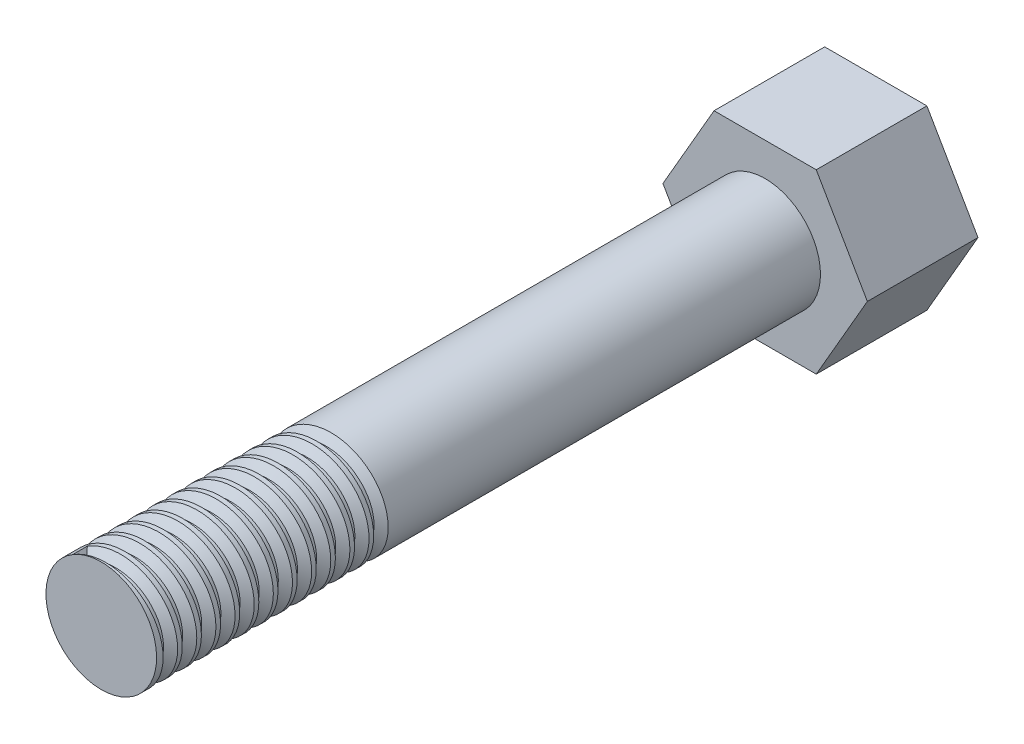
from build123d import *

# Parameters (mm, degrees)
SKETCH1_R           = 8
BOSS_EXTRUDE1_DEPTH = 5
SKETCH2_R           = 5
BOSS_EXTRUDE2_DEPTH = 60
THREAD1_PITCH       = 1.73


with BuildPart() as part:
    # Sketch1 → Boss-Extrude1 (new, symmetric)
    with BuildSketch(Plane.XY):
        with Locations((7.081982328, -5.944899528)):
            Circle(SKETCH1_R)
        Polygon((2.463180174, 2.055100472), (11.700784481, 2.055100472), (16.319586635, -5.944899528), (11.700784481, -13.944899528), (2.463180174, -13.944899528), (-2.155621979, -5.944899528), align=None)
    extrude(amount=BOSS_EXTRUDE1_DEPTH, both=True)

    # Sketch2 → Boss-Extrude2 (add)
    with BuildSketch(Plane.XY.offset(5)):
        with Locations((7.081982328, -5.944899528)):
            Circle(SKETCH2_R)
    extrude(amount=BOSS_EXTRUDE2_DEPTH)

    # Thread1: the profile of Thread Profile1 profile screwed along a right-hand helix of 11.560694 turns, 10 arcs to a turn; built about Z, then put on its axis
    thread1_z = Axis((0, 0, 0), (0, 0, 1))
    thread1_corners = [(5.0003, 0, -0.000173205), (5.0003, 0, 1.312673201), (4.188101188, 0, 0.843749998), (4.188101188, 0, 0.468749998)]
    with BuildLine(mode=Mode.PRIVATE) as thread1_profile:
        Line(thread1_corners[0], thread1_corners[1])
        Line(thread1_corners[1], thread1_corners[2])
        Line(thread1_corners[2], thread1_corners[3])
        Line(thread1_corners[3], thread1_corners[0])
    thread1_cap = Face(thread1_profile.wire())
    thread1_turn_angles = [0, 18, 36, 54, 72, 90, 108, 126, 144, 162, 180, 198, 216, 234, 252, 270, 288, 306, 324, 342, 360]
    thread1_turn_weights = [1, 0.9510565162951535, 1, 0.9510565162951535, 1, 0.9510565162951535, 1, 0.9510565162951535, 1, 0.9510565162951535, 1, 0.9510565162951535, 1, 0.9510565162951535, 1, 0.9510565162951535, 1, 0.9510565162951535, 1, 0.9510565162951535, 1]
    thread1_turn_rails = [Edge.make_bspline([Vector(p[0], p[1], 0).rotate(thread1_z, thread1_turn_angles[k]) / thread1_turn_weights[k] + Vector(0, 0, p[2] + THREAD1_PITCH * thread1_turn_angles[k] / 360) for k in range(21)], [0, 0, 0, 1, 1, 2, 2, 3, 3, 4, 4, 5, 5, 6, 6, 7, 7, 8, 8, 9, 9, 10, 10, 10], 2, thread1_turn_weights) for p in thread1_corners]
    thread1_turn_sides = [Face.make_surface_from_curves(thread1_turn_rails[p[0]], thread1_turn_rails[p[1]]) for p in [(0, 1), (1, 2), (2, 3), (3, 0)]]
    thread1_last_angles = [3960, 3978, 3996, 4014, 4032, 4050, 4068, 4086, 4104, 4122, 4140, 4150.924855491, 4161.849710983]
    thread1_last_weights = [1, 0.9510565162951535, 1, 0.9510565162951535, 1, 0.9510565162951535, 1, 0.9510565162951535, 1, 0.9510565162951535, 1, 0.9818765887764467, 1]
    thread1_last_rails = [Edge.make_bspline([Vector(p[0], p[1], 0).rotate(thread1_z, thread1_last_angles[k]) / thread1_last_weights[k] + Vector(0, 0, p[2] + THREAD1_PITCH * thread1_last_angles[k] / 360) for k in range(13)], [0, 0, 0, 1, 1, 2, 2, 3, 3, 4, 4, 5, 5, 6, 6, 6], 2, thread1_last_weights) for p in thread1_corners]
    thread1_last_sides = [Face.make_surface_from_curves(thread1_last_rails[p[0]], thread1_last_rails[p[1]]) for p in [(0, 1), (1, 2), (2, 3), (3, 0)]]
    thread1 = Plane(origin=(7.081982328, -5.944899528, 65), x_dir=(-0.515038075, 0.857167301, 0), z_dir=(0, 0, -1)) * Solid(Shell([*[p.moved(Location((0, 0, THREAD1_PITCH * i))) for i in range(11) for p in thread1_turn_sides], *thread1_last_sides, thread1_cap, thread1_cap.rotate(thread1_z, 4161.849710983).moved(Location((0, 0, THREAD1_PITCH * 4161.849710983 / 360)))]))
    add(thread1, mode=Mode.SUBTRACT)


solid = part.part
